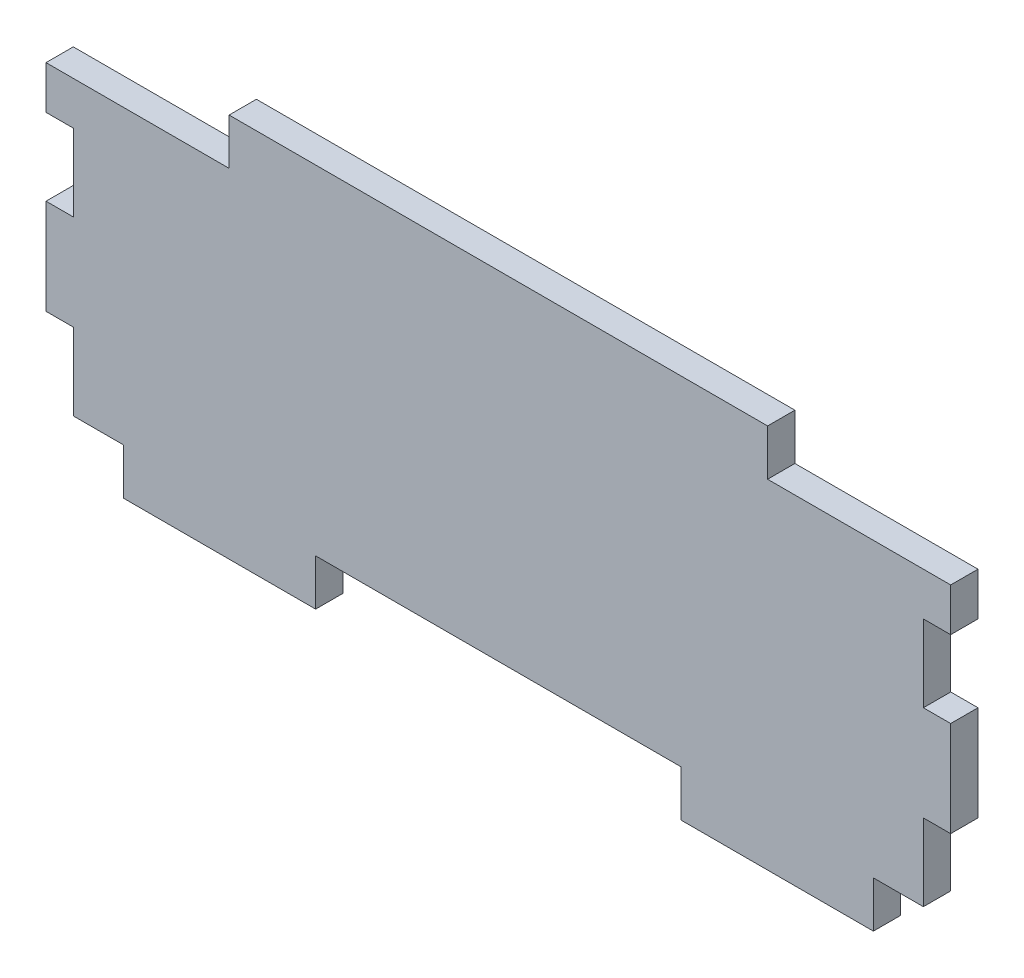
from build123d import *

# Parameters (mm, degrees)
BOSS_EXTRUDE1_DEPTH = 1.8034


with BuildPart() as part:
    # Sketch1 → Boss-Extrude1 (new body)
    with BuildSketch(Plane.XY):
        Polygon((1.8034, 9.8044), (0, 9.8044), (0, 4.7244), (-3.302, 4.7244), (-3.302, 1.6764), (-16.002, 1.6764), (-16.002, 4.7244), (-40.132, 4.7244), (-40.132, 1.6764), (-52.832, 1.6764), (-52.832, 4.7244), (-56.134, 4.7244), (-56.134, 9.8044), (-57.9374, 9.8044), (-57.9374, 16.1036), (-56.134, 16.1036), (-56.134, 21.1836), (-57.9374, 21.1836), (-57.9374, 24.0284), (-45.847, 24.0284), (-45.847, 27.0764), (-10.287, 27.0764), (-10.287, 24.0284), (1.8034, 24.0284), (1.8034, 21.1836), (0, 21.1836), (0, 16.1036), (1.8034, 16.1036), align=None)
    extrude(amount=BOSS_EXTRUDE1_DEPTH)


solid = part.part
